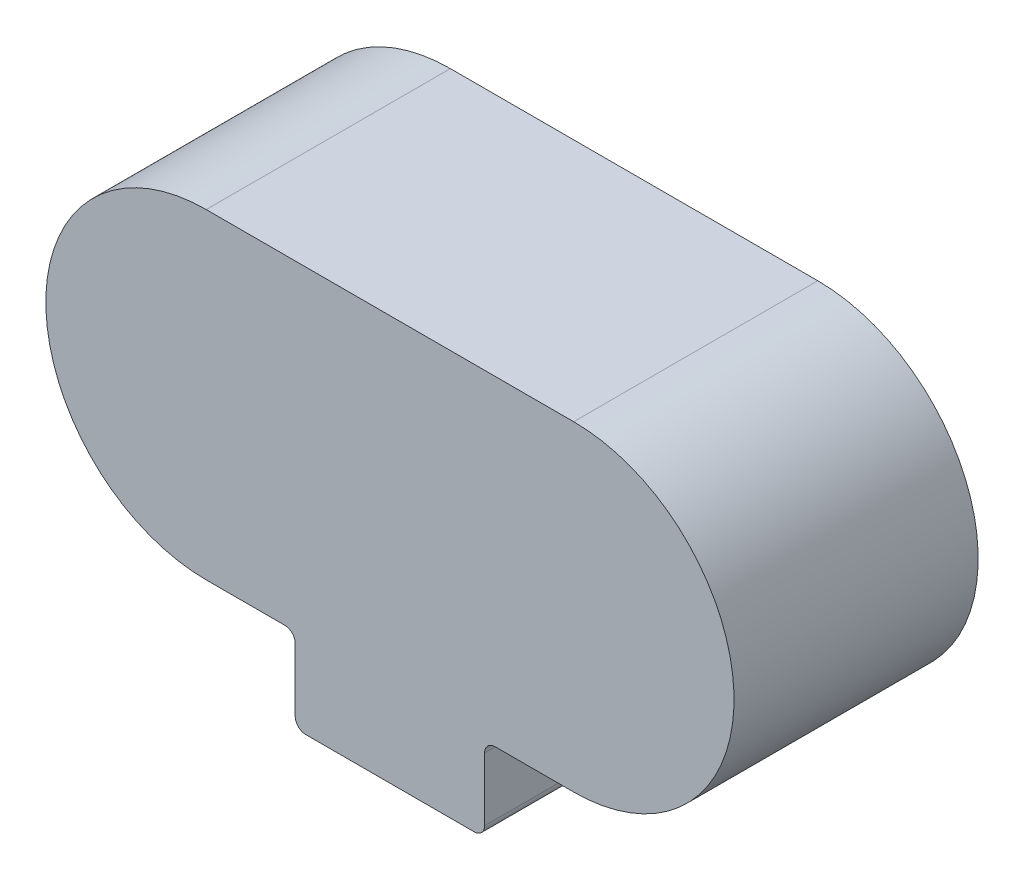
from build123d import *

# Parameters (mm, degrees)
THICKEN1_DEPTH      = 11.6
THICKEN1_START      = 10
THICKEN1_2_DEPTH    = 1.6
SKETCH2_R           = 1
BOSS_EXTRUDE1_DEPTH = 5
SKETCH3_W           = 9
SKETCH3_H           = 4
BOSS_EXTRUDE2_DEPTH = 4.5
CUT_EXTRUDE1_REACH  = 29.786
SKETCH4_RX          = 3.75
SKETCH4_RY          = 2.5
BOSS_EXTRUDE3_START = 7.5
BOSS_EXTRUDE3_DEPTH = 7.5
FILLET1_R           = 0.5
FILLET2_R           = 0.2


# Read off the part's stored shape, not the designer's step: Thicken1
with BuildPart() as part:
    # Thicken1 outline → Thicken1 (new body)
    with BuildSketch(Plane.XY):
        with BuildLine():
            Line((-8.73, -7.62), (8.73, -7.62))
            ThreePointArc((8.73, -7.62), (16.35, 0), (8.73, 7.62))
            Line((8.73, 7.62), (-8.73, 7.62))
            ThreePointArc((-8.73, 7.62), (-16.35, 0), (-8.73, -7.62))
        make_face()
        with BuildLine():
            ThreePointArc((8.73, 6.02), (14.75, 0), (8.73, -6.02))
            Line((8.73, -6.02), (-8.73, -6.02))
            ThreePointArc((-8.73, -6.02), (-14.75, 0), (-8.73, 6.02))
            Line((-8.73, 6.02), (8.73, 6.02))
        make_face(mode=Mode.SUBTRACT)
    extrude(amount=THICKEN1_DEPTH)

    # Thicken1 2 outline → Thicken1 2 (add)
    with BuildSketch(Plane.XY.offset(THICKEN1_START)):
        with BuildLine():
            Line((-8.73, -6.02), (8.73, -6.02))
            ThreePointArc((8.73, -6.02), (14.75, 0), (8.73, 6.02))
            Line((8.73, 6.02), (-8.73, 6.02))
            ThreePointArc((-8.73, 6.02), (-14.75, 0), (-8.73, -6.02))
        make_face()
    extrude(amount=THICKEN1_2_DEPTH)

    # Sketch2 → Boss-Extrude1 (add)
    with BuildSketch(Plane(origin=(0, 0, 10), x_dir=(-1, 0, 0), z_dir=(0, 0, -1))):
        with BuildLine():
            Line((1.6, 6.02), (-1.6, 6.02))
            Line((-1.6, 6.02), (-1.6, 2.537715508))
            ThreePointArc((-1.6, 2.537715508), (-2.537715508, -1.6), (1.6, -2.537715508))
            ThreePointArc((1.6, -2.537715508), (3, 0), (1.6, 2.537715508))
            Line((1.6, 2.537715508), (1.6, 6.02))
        make_face()
        Circle(SKETCH2_R, mode=Mode.SUBTRACT)
    extrude(amount=BOSS_EXTRUDE1_DEPTH)

    # Sketch3 → Boss-Extrude2 (add)
    with BuildSketch(Plane.XY.offset(11.6)):
        with Locations((0, -9.62)):
            Rectangle(SKETCH3_W, SKETCH3_H)
    extrude(amount=-BOSS_EXTRUDE2_DEPTH)

    # Cut-Extrude1: up to this face of the body (flat: up to its plane)
    cut_extrude1_end = Plane(part.part.faces().sort_by_distance((0, -6.02, 5))[0])
    # Sketch4 → Cut-Extrude1 (cut, up to the picked face)
    with BuildSketch(Plane.XZ.offset(11.62), mode=Mode.PRIVATE) as cut_extrude1_sk1:
        with Locations(Location((0, 7.1), (0, 0, 0))):
            Ellipse(SKETCH4_RX, SKETCH4_RY)
    cut_extrude1_tool1 = split(extrude(cut_extrude1_sk1.sketch, amount=-CUT_EXTRUDE1_REACH, mode=Mode.PRIVATE), bisect_by=cut_extrude1_end, keep=Keep.BOTH, mode=Mode.PRIVATE)
    add(cut_extrude1_tool1.solids().sort_by(Axis((0, -11.62, 7.1), (0, 1, 0)))[0], mode=Mode.SUBTRACT)

    # Sketch6 → Boss-Extrude3 (add)
    with BuildSketch(Plane(origin=(0, 0, 10), x_dir=(-1, 0, 0), z_dir=(0, 0, -1)).offset(BOSS_EXTRUDE3_START)):
        with BuildLine():
            Line((-12.421097398, -3.691097398), (-12.986782823, -4.256782823))
            ThreePointArc((-12.986782823, -4.256782823), (-14.75, 0), (-12.986782823, 4.256782823))
            Line((-12.986782823, 4.256782823), (-12.421097398, 3.691097398))
            ThreePointArc((-12.421097398, 3.691097398), (-13.95, 0), (-12.421097398, -3.691097398))
        make_face()
        with BuildLine():
            Line((12.986782823, -4.256782823), (12.421097398, -3.691097398))
            ThreePointArc((12.421097398, -3.691097398), (13.95, 0), (12.421097398, 3.691097398))
            Line((12.421097398, 3.691097398), (12.986782823, 4.256782823))
            ThreePointArc((12.986782823, 4.256782823), (14.75, 0), (12.986782823, -4.256782823))
        make_face()
    extrude(amount=-BOSS_EXTRUDE3_DEPTH)

    # Fillet1
    fillet1_edges = [part.edges().sort_by_distance(p)[0] for p in [
        (-4.5, -7.62, 9.35),
        (-4.5, -11.62, 9.35),
        (4.5, -7.62, 9.35),
        (4.5, -11.62, 9.35),
        (1.6, 2.537715508, 7.5),
        (1.6, 6.02, 7.5),
        (-1.6, 6.02, 7.5),
        (-1.6, 2.537715508, 7.5),
        (-12.986782823, -4.256782823, 6.25),
        (-12.986782823, 4.256782823, 6.25),
        (12.986782823, 4.256782823, 6.25),
        (12.986782823, -4.256782823, 6.25),
    ]]
    fillet(fillet1_edges, radius=FILLET1_R)

    # Fillet2
    fillet2_edges = [part.edges().sort_by_distance(p)[0] for p in [
        (12.421097398, -3.691097398, 6.25),
        (12.421097398, 3.691097398, 6.25),
        (-12.421097398, 3.691097398, 6.25),
        (-12.421097398, -3.691097398, 6.25),
    ]]
    fillet(fillet2_edges, radius=FILLET2_R)


solid = part.part
